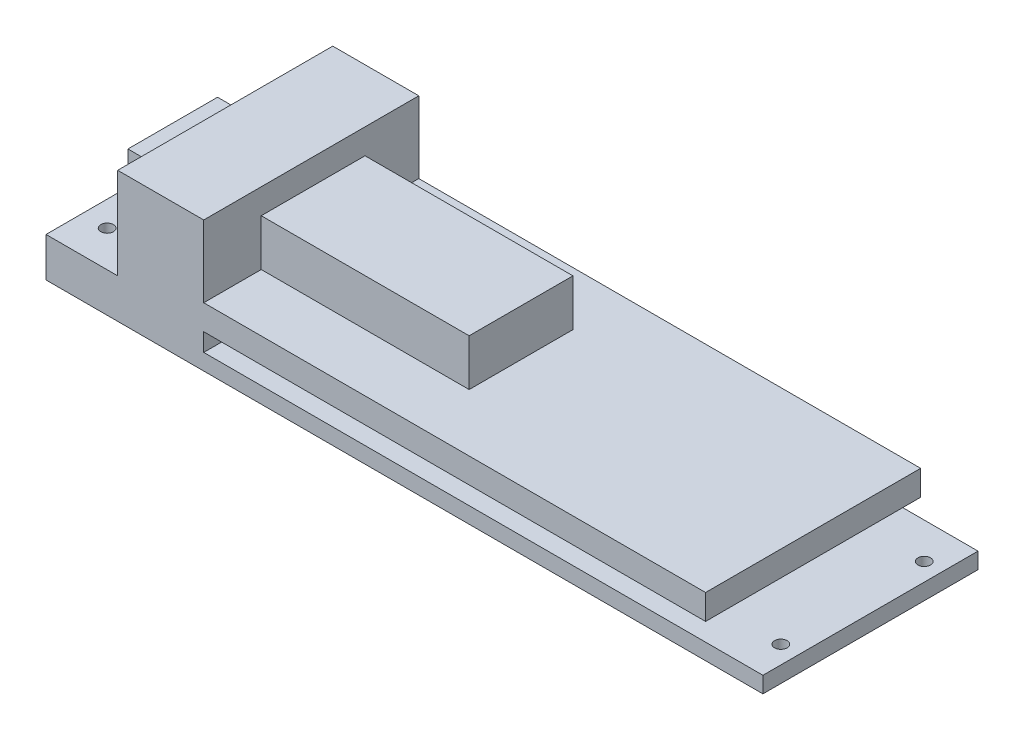
from build123d import *

# Parameters (mm, degrees)
SKETCH1_W           = 200
SKETCH1_H           = 60
SKETCH1_R           = 1.75
BOSS_EXTRUDE1_DEPTH = 4.5
SKETCH2_W           = 20
SKETCH2_H           = 60
BOSS_EXTRUDE2_DEPTH = 6.5
SKETCH3_W           = 24
SKETCH3_H           = 60
BOSS_EXTRUDE3_DEPTH = 32
SKETCH5_W           = 20
SKETCH5_H           = 25
BOSS_EXTRUDE4_DEPTH = 7
SKETCH6_W           = 140
SKETCH6_H           = 60
BOSS_EXTRUDE5_DEPTH = 7
SKETCH7_W           = 58
SKETCH7_H           = 28.953821303
BOSS_EXTRUDE6_DEPTH = 13
SKETCH8_R           = 1.75
CUT_EXTRUDE1_DEPTH  = 13


with BuildPart() as part:
    # Sketch1 → Boss-Extrude1 (new body)
    with BuildSketch(Plane(origin=(0, 0, 0), x_dir=(1, 0, 0), z_dir=(0, 1, 0))):
        Rectangle(SKETCH1_W, SKETCH1_H)
        with Locations((95, -20)):
            Circle(SKETCH1_R, mode=Mode.SUBTRACT)
        with Locations((95, 20)):
            Circle(SKETCH1_R, mode=Mode.SUBTRACT)
    extrude(amount=BOSS_EXTRUDE1_DEPTH)

    # Sketch2 → Boss-Extrude2 (add)
    with BuildSketch(Plane(origin=(0, 4.5, 0), x_dir=(1, 0, 0), z_dir=(0, 1, 0))):
        with Locations((-90, 0)):
            Rectangle(SKETCH2_W, SKETCH2_H)
    extrude(amount=BOSS_EXTRUDE2_DEPTH)

    # Sketch3 → Boss-Extrude3 (add)
    with BuildSketch(Plane(origin=(0, 4.5, 0), x_dir=(1, 0, 0), z_dir=(0, 1, 0))):
        with Locations((-68, 0)):
            Rectangle(SKETCH3_W, SKETCH3_H)
    extrude(amount=BOSS_EXTRUDE3_DEPTH)

    # Sketch5 → Boss-Extrude4 (add)
    with BuildSketch(Plane(origin=(0, 19, 0), x_dir=(1, 0, 0), z_dir=(0, 1, 0))):
        with Locations((-84.226759087, -0.419143158)):
            Rectangle(SKETCH5_W, SKETCH5_H)
    extrude(amount=BOSS_EXTRUDE4_DEPTH)

    # Sketch6 → Boss-Extrude5 (add)
    with BuildSketch(Plane(origin=(0, 9.5, 0), x_dir=(1, 0, 0), z_dir=(0, 1, 0))):
        with Locations((14, 0)):
            Rectangle(SKETCH6_W, SKETCH6_H)
    extrude(amount=BOSS_EXTRUDE5_DEPTH)

    # Sketch7 → Boss-Extrude6 (add)
    with BuildSketch(Plane(origin=(0, 16.5, 0), x_dir=(1, 0, 0), z_dir=(0, 1, 0))):
        with Locations((-27, 0.523089349)):
            Rectangle(SKETCH7_W, SKETCH7_H)
    extrude(amount=BOSS_EXTRUDE6_DEPTH)

    # Sketch8 → Cut-Extrude1 (cut)
    with BuildSketch(Plane.XZ):
        with Locations((-93, -20)):
            Circle(SKETCH8_R)
        with Locations((-93, 19.955464874)):
            Circle(SKETCH8_R)
    extrude(amount=-CUT_EXTRUDE1_DEPTH, mode=Mode.SUBTRACT)


solid = part.part
